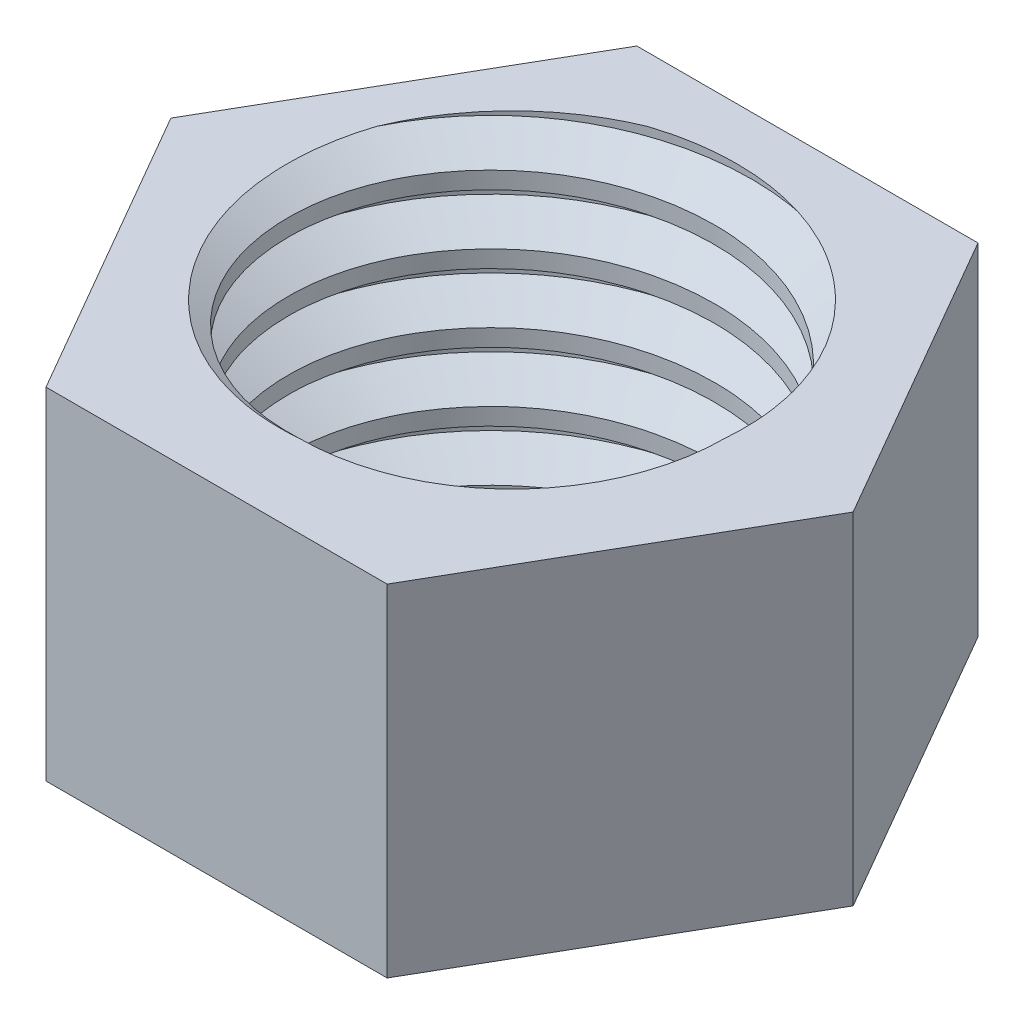
from build123d import *

# Parameters (mm, degrees)
EXTRUDE_1_DEPTH     = 4
SKETCH_4_R          = 2.5
CUT_EXTRUDE_2_DEPTH = 7.633249581
THREAD_1_PITCH      = 0.8


with BuildPart() as part:
    # Sketch 1 → 凸台-拉伸1 (new body)
    with BuildSketch(Plane(origin=(0, 0, 0), x_dir=(1, 0, 0), z_dir=(0, 1, 0))):
        Polygon((4, 0), (2, 3.464101615), (-2, 3.464101615), (-4, 0), (-2, -3.464101615), (2, -3.464101615), align=None)
    extrude(amount=EXTRUDE_1_DEPTH)

    # 草图4 → 切除-拉伸2 (cut, through all)
    with BuildSketch(Plane(origin=(0, 4, 0), x_dir=(1, 0, 0), z_dir=(0, 1, 0))):
        with Locations(Location((0, 0, 0), (0, 0, 270))):
            Circle(SKETCH_4_R)
    extrude(amount=-CUT_EXTRUDE_2_DEPTH, mode=Mode.SUBTRACT)

    # 螺纹线1: the profile of Sketch 1 2 profile screwed along a right-hand helix of 10 turns, 8 arcs to a turn; built about Z, then put on its axis
    thread_1_z = Axis((0, 0, 0), (0, 0, 1))
    thread_1_corners = [(2.4997, 0, -0.000173205), (2.9330127, 0, 0.249999999), (2.9330127, 0, 0.349999999), (2.4997, 0, 0.600173203)]
    with BuildLine(mode=Mode.PRIVATE) as thread_1_profile:
        Line(thread_1_corners[0], thread_1_corners[1])
        Line(thread_1_corners[1], thread_1_corners[2])
        Line(thread_1_corners[2], thread_1_corners[3])
        Line(thread_1_corners[3], thread_1_corners[0])
    thread_1_cap = Face(thread_1_profile.wire())
    thread_1_turn_angles = [0, 22.5, 45, 67.5, 90, 112.5, 135, 157.5, 180, 202.5, 225, 247.5, 270, 292.5, 315, 337.5, 360]
    thread_1_turn_weights = [1, 0.9238795325112867, 1, 0.9238795325112867, 1, 0.9238795325112867, 1, 0.9238795325112867, 1, 0.9238795325112867, 1, 0.9238795325112867, 1, 0.9238795325112867, 1, 0.9238795325112867, 1]
    thread_1_turn_rails = [Edge.make_bspline([Vector(p[0], p[1], 0).rotate(thread_1_z, thread_1_turn_angles[k]) / thread_1_turn_weights[k] + Vector(0, 0, p[2] + THREAD_1_PITCH * thread_1_turn_angles[k] / 360) for k in range(17)], [0, 0, 0, 1, 1, 2, 2, 3, 3, 4, 4, 5, 5, 6, 6, 7, 7, 8, 8, 8], 2, thread_1_turn_weights) for p in thread_1_corners]
    thread_1_turn_sides = [Face.make_surface_from_curves(thread_1_turn_rails[p[0]], thread_1_turn_rails[p[1]]) for p in [(0, 1), (1, 2), (2, 3), (3, 0)]]
    thread_1 = Plane(origin=(0, 6, 0), x_dir=(-1, 0, 0), z_dir=(0, -1, 0)) * Solid(Shell([*[p.moved(Location((0, 0, THREAD_1_PITCH * i))) for i in range(10) for p in thread_1_turn_sides], thread_1_cap, thread_1_cap.rotate(thread_1_z, 3600).moved(Location((0, 0, THREAD_1_PITCH * 3600 / 360)))]))
    add(thread_1, mode=Mode.SUBTRACT)


solid = part.part
